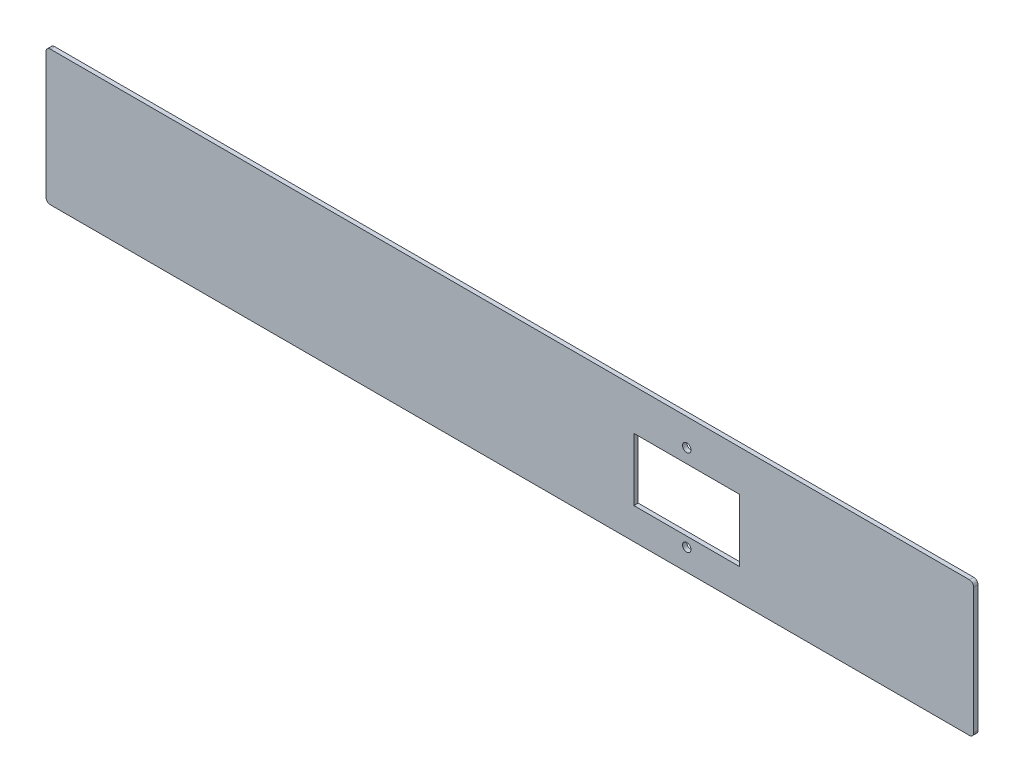
from build123d import *

# Parameters (mm, degrees)
SKETCH1_W           = 430
SKETCH1_H           = 62.5
SKETCH1_R           = 1.95
SKETCH1_W_2         = 49
SKETCH1_H_2         = 29
BOSS_EXTRUDE1_DEPTH = 2
FILLET1_R           = 2


with BuildPart() as part:
    # Sketch1 → Boss-Extrude1 (new body)
    with BuildSketch(Plane.XY):
        with Locations((-136.924811832, -1.046482412)):
            Rectangle(SKETCH1_W, SKETCH1_H)
        with Locations((-54.924811832, 17.703517588)):
            Circle(SKETCH1_R, mode=Mode.SUBTRACT)
        with Locations((-54.924811832, -22.296482412)):
            Circle(SKETCH1_R, mode=Mode.SUBTRACT)
        with Locations((-54.924811832, -3.296482412)):
            Rectangle(SKETCH1_W_2, SKETCH1_H_2, mode=Mode.SUBTRACT)
    extrude(amount=BOSS_EXTRUDE1_DEPTH)

    # Fillet1
    fillet1_edges = [part.edges().sort_by_distance(p)[0] for p in [
        (78.075188168, 30.203517588, 1),
        (78.075188168, -32.296482412, 1),
        (-351.924811832, -32.296482412, 1),
        (-351.924811832, 30.203517588, 1),
    ]]
    fillet(fillet1_edges, radius=FILLET1_R)


solid = part.part
